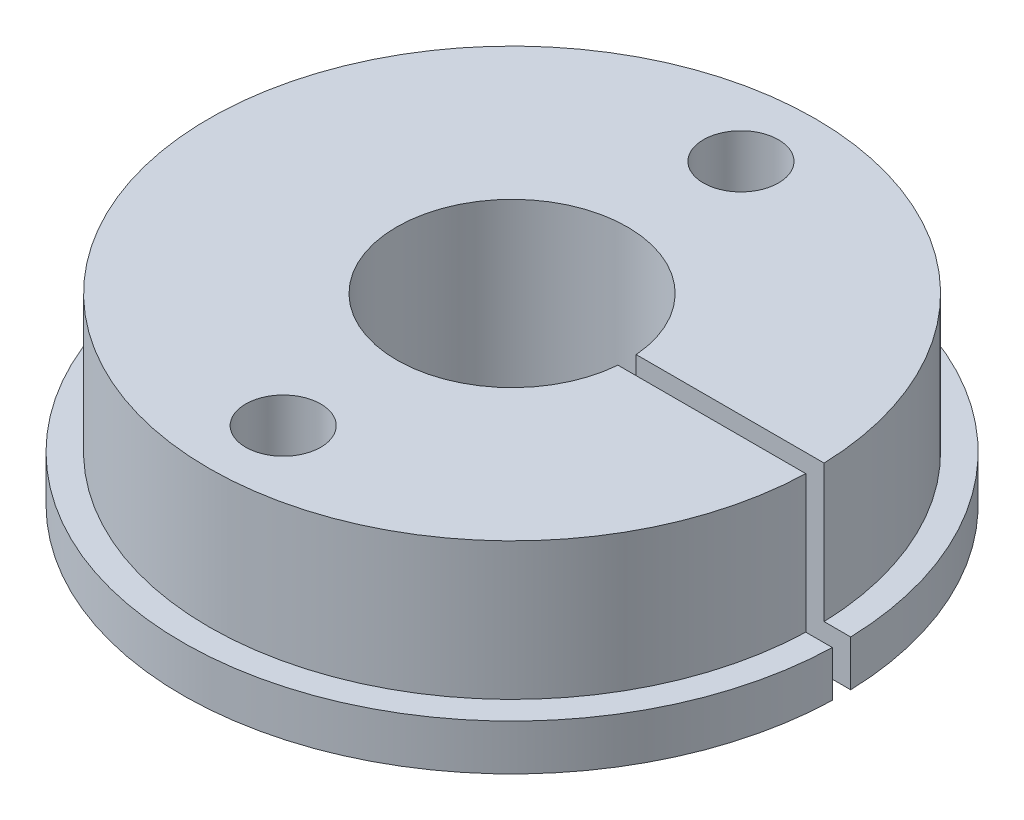
from build123d import *

# Parameters (mm, degrees)
BOSS_EXTRUDE1_DEPTH = 5
BOSS_EXTRUDE2_DEPTH = 15
CUT_EXTRUDE1_REACH  = 56.699
SKETCH3_R           = 4.1
CUT_EXTRUDE2_DEPTH  = 6.4
SKETCH9_W           = 13
SKETCH9_H           = 18
CUT_EXTRUDE3_DEPTH  = 55.699177325


# Read off the part's stored shape, not the designer's step: Boss-Extrude2
with BuildPart() as part:
    # Sketch1 → Boss-Extrude1 (new body)
    with BuildSketch(Plane(origin=(0, 0, 0), x_dir=(1, 0, 0), z_dir=(0, 1, 0))):
        with BuildLine():
            Line((35.986108431, -1), (12.560254774, -1))
            ThreePointArc((12.560254774, -1), (-12.6, 0), (12.560254774, 1))
            Line((12.560254774, 1), (35.986108431, 1))
            ThreePointArc((35.986108431, 1), (-36, 0), (35.986108431, -1))
        make_face()
    extrude(amount=BOSS_EXTRUDE1_DEPTH)

    # Boss-Extrude2 outline → Boss-Extrude2 (add)
    with BuildSketch(Plane(origin=(0, 5, 0), x_dir=(1, 0, 0), z_dir=(0, 1, 0))):
        with BuildLine():
            Line((33.084890811, -1), (12.560254774, -1))
            ThreePointArc((12.560254774, -1), (-12.6, 0), (12.560254774, 1))
            Line((12.560254774, 1), (33.084890811, 1))
            ThreePointArc((33.084890811, 1), (-33.1, 0), (33.084890811, -1))
        make_face()
    extrude(amount=BOSS_EXTRUDE2_DEPTH)

    # Sketch3 → Cut-Extrude1 (cut, up to next)
    with BuildSketch(Plane.XZ, mode=Mode.PRIVATE) as cut_extrude1_sk1:
        with Locations(Location((0, 25, 0), (0, 0, 270))):
            Circle(SKETCH3_R)
    cut_extrude1_tool1 = extrude(cut_extrude1_sk1.sketch, amount=-CUT_EXTRUDE1_REACH, mode=Mode.PRIVATE) & part.part
    # Sketch3 → Cut-Extrude1 (cut, up to next)
    with BuildSketch(Plane.XZ, mode=Mode.PRIVATE) as cut_extrude1_sk2:
        with Locations(Location((0, -25, 0), (0, 0, 270))):
            Circle(SKETCH3_R)
    cut_extrude1_tool2 = extrude(cut_extrude1_sk2.sketch, amount=-CUT_EXTRUDE1_REACH, mode=Mode.PRIVATE) & part.part
    add(cut_extrude1_tool1.solids().sort_by_distance((0, 0, 25))[0], mode=Mode.SUBTRACT)
    add(cut_extrude1_tool2.solids().sort_by_distance((0, 0, -25))[0], mode=Mode.SUBTRACT)

    # Sketch8 → Cut-Extrude2 (cut)
    with BuildSketch(Plane.XZ):
        Polygon((6.618426782, 21.22158407), (6.581417572, 28.842517761), (-0.03700921, 32.620933691), (-6.618426782, 28.77841593), (-6.581417572, 21.157482239), (0.03700921, 17.379066309), align=None)
        Polygon((6.618426782, -28.77841593), (6.581417572, -21.157482239), (-0.03700921, -17.379066309), (-6.618426782, -21.22158407), (-6.581417572, -28.842517761), (0.03700921, -32.620933691), align=None)
    extrude(amount=-CUT_EXTRUDE2_DEPTH, mode=Mode.SUBTRACT)

    # Sketch9 → Cut-Extrude3 (cut, through all)
    with BuildSketch(Plane(origin=(0, 20, 0), x_dir=(1, 0, 0), z_dir=(0, 1, 0))):
        with Locations((-40, 0)):
            Rectangle(SKETCH9_W, SKETCH9_H)
    extrude(amount=-CUT_EXTRUDE3_DEPTH, mode=Mode.SUBTRACT)


solid = part.part
